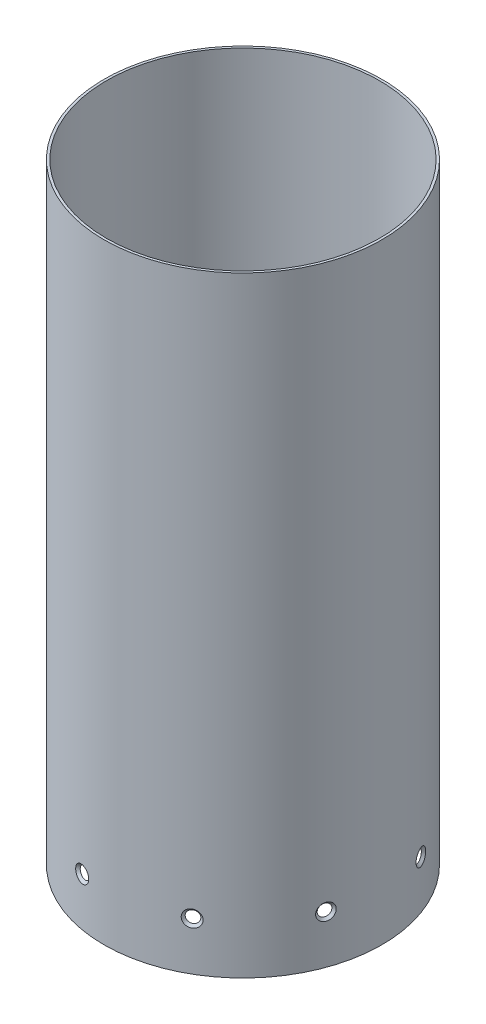
from build123d import *

# Parameters (mm, degrees)
SKETCH1_R           = 86.5
SKETCH1_R_2         = 85
BOSS_EXTRUDE1_DEPTH = 380
CUT_EXTRUDE1_REACH  = 428.393
SKETCH2_R           = 2.75
CIRPATTERN1_COUNT   = 9


with BuildPart() as part:
    # Sketch1 → Boss-Extrude1 (new body)
    with BuildSketch(Plane(origin=(0, 0, 0), x_dir=(1, 0, 0), z_dir=(0, 1, 0))):
        Circle(SKETCH1_R)
        Circle(SKETCH1_R_2, mode=Mode.SUBTRACT)
    extrude(amount=BOSS_EXTRUDE1_DEPTH)

    # Sketch2 → Cut-Extrude1 (cut, up to next)
    with BuildSketch(Plane.ZY.offset(86.5), mode=Mode.PRIVATE) as cut_extrude1_sk1:
        with Locations((0, 30)):
            Circle(SKETCH2_R)
    cut_extrude1_tool1 = extrude(cut_extrude1_sk1.sketch, amount=-CUT_EXTRUDE1_REACH, mode=Mode.PRIVATE) & part.part
    add(cut_extrude1_tool1.solids().sort_by_distance((-86.5, 30, 0))[0], mode=Mode.SUBTRACT)

    # Sketch4 → Cut-Revolve1 (revolve, cut)
    with BuildSketch(Plane.XZ.offset(-30)):
        Polygon((-86.355370418, -5), (-81.355370418, 0), (-86.355370418, 0), (-87.969003707, 0), (-87.969003707, -6.613633289), align=None)
    cut_revolve1 = revolve(axis=Axis((-93.993729437, 30, 0), (1, 0, 0)), mode=Mode.SUBTRACT)

    # CirPattern1: Cut-Revolve1 ×9 about axis
    cirpattern1_axis = Axis((0, 0, 0), (0, 1, 0))
    for i in range(1, CIRPATTERN1_COUNT):
        add(cut_revolve1.rotate(cirpattern1_axis, i * 360 / CIRPATTERN1_COUNT), mode=Mode.SUBTRACT)


solid = part.part
